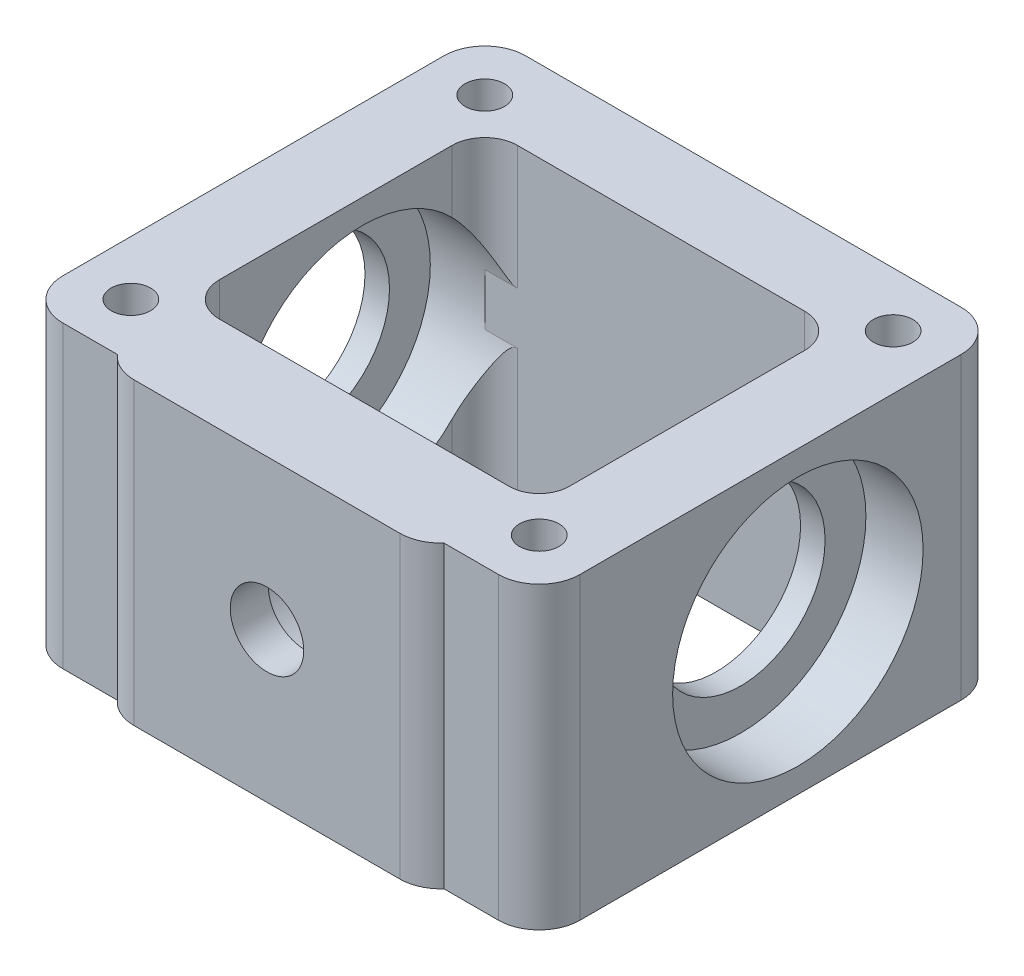
from build123d import *

# Parameters (mm, degrees)
SKETCH3_W           = 38
SKETCH3_H           = 34
SKETCH3_W_2         = 26
SKETCH3_H_2         = 22
BOSS_EXTRUDE1_DEPTH = 22
SKETCH4_W           = 24
SKETCH4_H           = 22
BOSS_EXTRUDE2_DEPTH = 1
SKETCH5_R           = 2.7
CUT_EXTRUDE1_DEPTH  = 12
SKETCH7_R           = 5.7
CUT_EXTRUDE3_DEPTH  = 4.2
SKETCH8_R           = 6.2
CUT_EXTRUDE4_DEPTH  = 57.151580565
SKETCH9_R           = 9.2
CUT_EXTRUDE5_DEPTH  = 4.2
SKETCH10_R          = 9.2
CUT_EXTRUDE6_DEPTH  = 4.2
SKETCH15_R          = 1.45
CUT_EXTRUDE7_DEPTH  = 57.151580565
FILLET1_R           = 3
FILLET3_R           = 2.5
FILLET4_R           = 2.2
FILLET5_R           = 2.4


with BuildPart() as part:
    # Sketch3 → Boss-Extrude1 (new body)
    with BuildSketch(Plane(origin=(0, 0, 0), x_dir=(1, 0, 0), z_dir=(0, 1, 0))):
        with Locations((19, -17)):
            Rectangle(SKETCH3_W, SKETCH3_H)
        with Locations((19, -17)):
            Rectangle(SKETCH3_W_2, SKETCH3_H_2, mode=Mode.SUBTRACT)
    extrude(amount=BOSS_EXTRUDE1_DEPTH)

    # Sketch4 → Boss-Extrude2 (add)
    with BuildSketch(Plane.XY.offset(34)):
        with Locations((19, 11)):
            Rectangle(SKETCH4_W, SKETCH4_H)
    extrude(amount=BOSS_EXTRUDE2_DEPTH)

    # Sketch5 → Cut-Extrude1 (cut)
    with BuildSketch(Plane.XY.offset(35)):
        with Locations((19, 11)):
            Circle(SKETCH5_R)
    extrude(amount=-CUT_EXTRUDE1_DEPTH, mode=Mode.SUBTRACT)

    # Sketch7 → Cut-Extrude3 (cut)
    with BuildSketch(Plane(origin=(0, 0, 28), x_dir=(-1, 0, 0), z_dir=(0, 0, -1))):
        with Locations((-19, 11)):
            Circle(SKETCH7_R)
    extrude(amount=-CUT_EXTRUDE3_DEPTH, mode=Mode.SUBTRACT)

    # Sketch8 → Cut-Extrude4 (cut, through all)
    with BuildSketch(Plane(origin=(38, 0, 0), x_dir=(0, 0, -1), z_dir=(1, 0, 0))):
        with Locations((-15, 11)):
            Circle(SKETCH8_R)
    extrude(amount=-CUT_EXTRUDE4_DEPTH, mode=Mode.SUBTRACT)

    # Sketch9 → Cut-Extrude5 (cut)
    with BuildSketch(Plane(origin=(6, 0, 0), x_dir=(0, 0, -1), z_dir=(1, 0, 0))):
        with Locations((-15, 11)):
            Circle(SKETCH9_R)
    extrude(amount=-CUT_EXTRUDE5_DEPTH, mode=Mode.SUBTRACT)

    # Sketch10 → Cut-Extrude6 (cut)
    with BuildSketch(Plane(origin=(38, 0, 0), x_dir=(0, 0, -1), z_dir=(1, 0, 0))):
        with Locations((-15, 11)):
            Circle(SKETCH10_R)
    extrude(amount=-CUT_EXTRUDE6_DEPTH, mode=Mode.SUBTRACT)

    # Sketch15 → Cut-Extrude7 (cut, through all)
    with BuildSketch(Plane(origin=(0, 0, 0), x_dir=(-1, 0, 0), z_dir=(0, -1, 0))):
        with Locations(Location((-4, -30, 0), (0, 0, 90))):
            Circle(SKETCH15_R)
        with Locations(Location((-34, -30, 0), (0, 0, 90))):
            Circle(SKETCH15_R)
        with Locations(Location((-34, -4, 0), (0, 0, 90))):
            Circle(SKETCH15_R)
        with Locations(Location((-4, -4, 0), (0, 0, 90))):
            Circle(SKETCH15_R)
    extrude(amount=-CUT_EXTRUDE7_DEPTH, mode=Mode.SUBTRACT)

    # Fillet1
    # the kernel refuses this fillet: 3 mm, written as the material it takes off along each edge
    with BuildSketch(Plane(origin=(38, -7.5, 0), x_dir=(-1, 0, 0), z_dir=(0, 1, 0)), Plane(origin=(38, -7.5, 34), x_dir=(0, 0, -1), z_dir=(0, 1, 0))) as fillet1_piece_1:
        with BuildLine():
            CenterArc((FILLET1_R, FILLET1_R), FILLET1_R, 180, 90)
            Line((0, FILLET1_R), (-FILLET1_R * 0.02, FILLET1_R))
            Line((-FILLET1_R * 0.02, FILLET1_R), (-FILLET1_R * 0.02, -FILLET1_R * 0.02))
            Line((-FILLET1_R * 0.02, -FILLET1_R * 0.02), (FILLET1_R, -FILLET1_R * 0.02))
            Line((FILLET1_R, -FILLET1_R * 0.02), (FILLET1_R, 0))
        make_face()
    extrude(amount=37, mode=Mode.SUBTRACT)
    with BuildSketch(Plane(origin=(7, -5.590169944, 35), x_dir=(0, 0, -1), z_dir=(0, 1, 0)), Plane(origin=(31, 27.590169944, 35), x_dir=(0, 0, -1), z_dir=(0, -1, 0))) as fillet1_piece_2:
        with BuildLine():
            CenterArc((3, -2.236067977), FILLET1_R, 131.810314896, 48.189685104)
            Line((0, -2.236067977), (-0.06, -2.236067977))
            Line((-0.06, -2.236067977), (-0.06, 0))
            Line((-0.06, 0), (0, 0.06))
            ThreePointArc((0, 0.06), (0.5, 0.06), (0.96, 0.04472136))
            Line((0.96, 0.04472136), (1, 0))
        make_face()
    extrude(amount=33.180339887, mode=Mode.SUBTRACT)
    with BuildSketch(Plane(origin=(0, -7.5, 34), x_dir=(0, 0, -1), z_dir=(0, 1, 0)), Plane(origin=(0, -7.5, 0), x_dir=(1, 0, 0), z_dir=(0, 1, 0))) as fillet1_piece_3:
        with BuildLine():
            CenterArc((FILLET1_R, -FILLET1_R), FILLET1_R, 90, 90)
            Line((0, -FILLET1_R), (-FILLET1_R * 0.02, -FILLET1_R))
            Line((-FILLET1_R * 0.02, -FILLET1_R), (-FILLET1_R * 0.02, FILLET1_R * 0.02))
            Line((-FILLET1_R * 0.02, FILLET1_R * 0.02), (FILLET1_R, FILLET1_R * 0.02))
            Line((FILLET1_R, FILLET1_R * 0.02), (FILLET1_R, 0))
        make_face()
    extrude(amount=37, mode=Mode.SUBTRACT)

    # Fillet3
    fillet3_edges = [part.edges().sort_by_distance(p)[0] for p in [
        (6, 11, 28),
        (32, 11, 6),
    ]]
    fillet(fillet3_edges, radius=FILLET3_R)

    # Fillet4
    fillet4_edges = [part.edges().sort_by_distance(p)[0] for p in [
        (32, 11, 28),
    ]]
    fillet(fillet4_edges, radius=FILLET4_R)

    # Fillet5
    # the kernel refuses this fillet: 2.4 mm, written as the material it adds along each edge
    with BuildSketch(Plane(origin=(6, 6.907878403, 6), x_dir=(0, 0, 1), z_dir=(0, 1, 0))) as fillet5_piece_1_section:
        with BuildLine():
            CenterArc((FILLET5_R, FILLET5_R), FILLET5_R, 180, 90)
            Line((0, FILLET5_R), (0, 0))
            Line((0, 0), (FILLET5_R, 0))
        make_face()
    fillet5_piece_1 = extrude(amount=15.092121597, mode=Mode.PRIVATE)
    fillet5_piece_1 = fillet5_piece_1 - Plane(origin=(6.778295216, 11, 15), x_dir=(0, 0, -1), z_dir=(1, 0, 0)) * Cylinder(9.2, 40, mode=Mode.PRIVATE)
    add(fillet5_piece_1)
    with BuildSketch(Plane(origin=(6, 0, 6), x_dir=(0, 0, 1), z_dir=(0, 1, 0))) as fillet5_piece_2_section:
        with BuildLine():
            CenterArc((FILLET5_R, FILLET5_R), FILLET5_R, 180, 90)
            Line((0, FILLET5_R), (0, 0))
            Line((0, 0), (FILLET5_R, 0))
        make_face()
    fillet5_piece_2 = extrude(amount=15.092121597, mode=Mode.PRIVATE)
    fillet5_piece_2 = fillet5_piece_2 - Plane(origin=(6.572967992, 11, 15), x_dir=(0, 0, -1), z_dir=(1, 0, 0)) * Cylinder(9.2, 40, mode=Mode.PRIVATE)
    add(fillet5_piece_2)


solid = part.part
